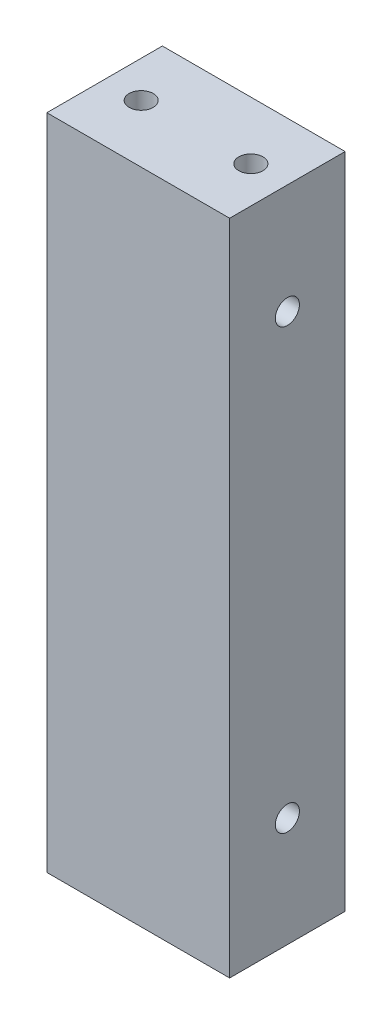
from build123d import *

# Parameters (mm, degrees)
SKETCH1_W                      = 25
SKETCH1_H                      = 90
BOSS_EXTRUDE1_DEPTH            = 15.8
M4X0_7_TAPPED_HOLE2_D          = 3.3
M4X0_7_TAPPED_HOLE2_DEPTH      = 10.1
M4X0_7_TAPPED_HOLE2_TIP        = 0.991420021
M4X0_7_TAPPED_HOLE1_D          = 3.3
M4X0_7_TAPPED_HOLE1_DEPTH      = 10
M4X0_7_TAPPED_HOLE1_TIP        = 0.991420021
M4X0_7_TAPPED_HOLE3_AT_2_COUNT = 2
M4X0_7_TAPPED_HOLE3_AT_2_PITCH = 15


with BuildPart() as part:
    # Sketch1 → Boss-Extrude1 (new body)
    with BuildSketch(Plane.XY):
        Rectangle(SKETCH1_W, SKETCH1_H)
    extrude(amount=BOSS_EXTRUDE1_DEPTH)

    # M4x0.7 Tapped Hole2
    with Locations(Plane(origin=(12.5, 0, 0), x_dir=(0, 0, -1), z_dir=(1, 0, 0))):
        with Locations((-7.9, 30), (-7.9, -30)):
            Hole(M4X0_7_TAPPED_HOLE2_D / 2, depth=M4X0_7_TAPPED_HOLE2_DEPTH)
            with Locations((0, 0, -(M4X0_7_TAPPED_HOLE2_DEPTH + M4X0_7_TAPPED_HOLE2_TIP / 2))):  # 118° drill point
                Cone(0, M4X0_7_TAPPED_HOLE2_D / 2, M4X0_7_TAPPED_HOLE2_TIP, mode=Mode.SUBTRACT)

    # M4x0.7 Tapped Hole1
    with Locations(Plane.ZY.offset(12.5)):
        with Locations((3.9, 30), (11.9, 30), (11.9, -30), (3.9, -30)):
            Hole(M4X0_7_TAPPED_HOLE1_D / 2, depth=M4X0_7_TAPPED_HOLE1_DEPTH)
            with Locations((0, 0, -(M4X0_7_TAPPED_HOLE1_DEPTH + M4X0_7_TAPPED_HOLE1_TIP / 2))):  # 118° drill point
                Cone(0, M4X0_7_TAPPED_HOLE1_D / 2, M4X0_7_TAPPED_HOLE1_TIP, mode=Mode.SUBTRACT)

    # Sketch8 → M4x0.7 Tapped Hole3 (revolve, cut)
    with BuildSketch(Plane(origin=(7.5, -45, 7.9), x_dir=(0, 0, -1), z_dir=(1, 0, 0))):
        Polygon((0, 0), (0, 11.091420021), (1.65, 10.1), (1.65, 0), align=None)
    m4x0_7_tapped_hole3 = revolve(axis=Axis((7.5, -51.35, 7.9), (0, 1, 0)), mode=Mode.SUBTRACT)

    # M4x0.7 Tapped Hole3 at 2: M4x0.7 Tapped Hole3 ×2
    with Locations(*[(-i * M4X0_7_TAPPED_HOLE3_AT_2_PITCH, 0, 0) for i in range(1, M4X0_7_TAPPED_HOLE3_AT_2_COUNT)]):
        add(m4x0_7_tapped_hole3, mode=Mode.SUBTRACT)

    # Mirror1: M4x0.7 Tapped Hole3 across plane
    add(m4x0_7_tapped_hole3.mirror(Plane.ZX), mode=Mode.SUBTRACT)

    # Mirror1 copy 1 sketch → Mirror1 copy 1 (revolve, cut)
    with BuildSketch(Plane(origin=(-7.5, 45, 7.9), x_dir=(0, 0, -1), z_dir=(1, 0, 0))):
        Polygon((0, 0), (0, -11.091420021), (1.65, -10.1), (1.65, 0), align=None)
    revolve(axis=Axis((-7.5, 51.35, 7.9), (0, 1, 0)), mode=Mode.SUBTRACT)


solid = part.part
